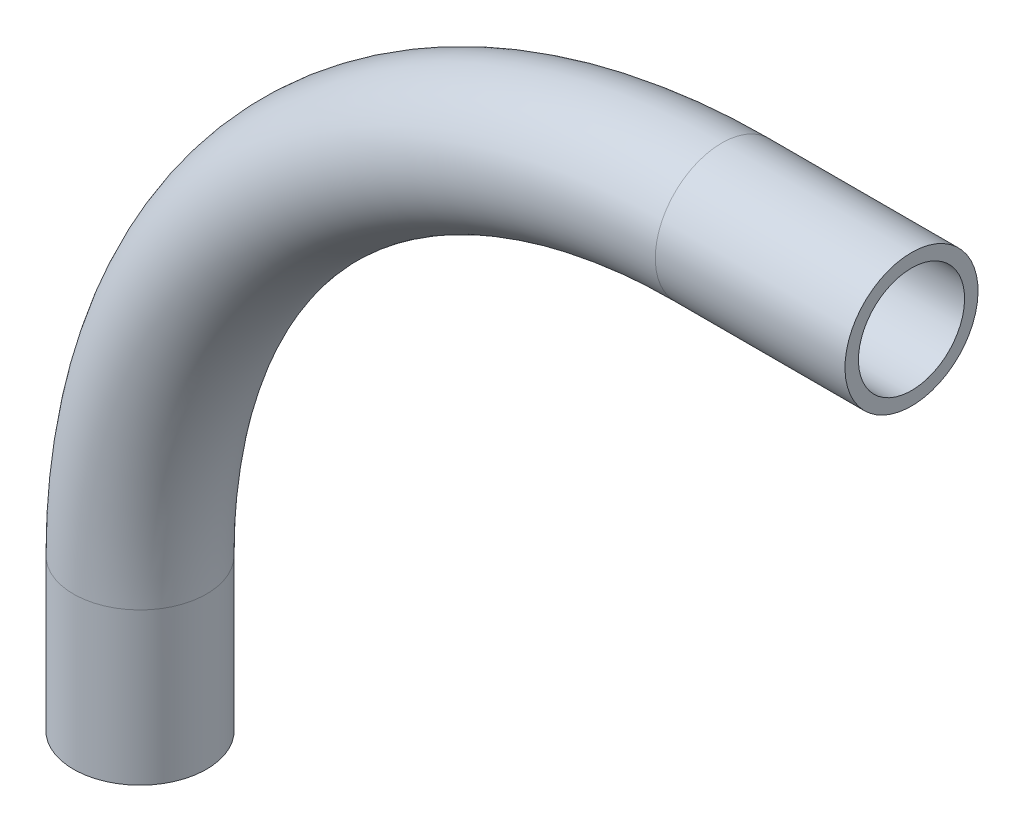
from build123d import *

# Parameters (mm, degrees)
ROUTE_R                       = 16.7005
ELBOWSHELL_T                  = -3.3782
SKETCH2_R                     = 16.7005
SKETCH2_R_2                   = 13.3223
ELBOWEXTENSION_EXTRUDE1_DEPTH = 47.625
SKETCH3_R                     = 16.7005
SKETCH3_R_2                   = 13.3223
ELBOWEXTENSION_EXTRUDE2_DEPTH = 38.1


with BuildPart() as part:
    # Elbow: sweep along a path in ElbowArc
    with BuildLine(Plane.XY) as elbow_path:
        ThreePointArc((-146.05, 0), (-103.272945392, 103.272945392), (0, 146.05))
    # Route → Elbow (sweep)
    with BuildSketch(Plane(origin=(0, 0, 0), x_dir=(1, 0, 0), z_dir=(0, 1, 0))):
        with Locations((-146.05, 0)):
            Circle(ROUTE_R)
    sweep(path=elbow_path.line)

    # ElbowShell
    elbowshell_openings = [part.faces().sort_by_distance(p)[0] for p in [
        (0, 146.05, 0),
        (-146.05, 0, 0),
    ]]
    offset(amount=ELBOWSHELL_T, openings=elbowshell_openings, kind=Kind.INTERSECTION)

    # Sketch2 → ElbowExtension-Extrude1 (add)
    with BuildSketch(Plane(origin=(0, 0, 0), x_dir=(0, 0, -1), z_dir=(1, 0, 0))):
        with Locations((0, 146.05)):
            Circle(SKETCH2_R)
        with Locations((0, 146.05)):
            Circle(SKETCH2_R_2, mode=Mode.SUBTRACT)
    extrude(amount=ELBOWEXTENSION_EXTRUDE1_DEPTH)

    # Sketch3 → ElbowExtension-Extrude2 (add)
    with BuildSketch(Plane.XZ):
        with Locations((-146.05, 0)):
            Circle(SKETCH3_R)
        with Locations((-146.05, 0)):
            Circle(SKETCH3_R_2, mode=Mode.SUBTRACT)
    extrude(amount=ELBOWEXTENSION_EXTRUDE2_DEPTH)


solid = part.part
